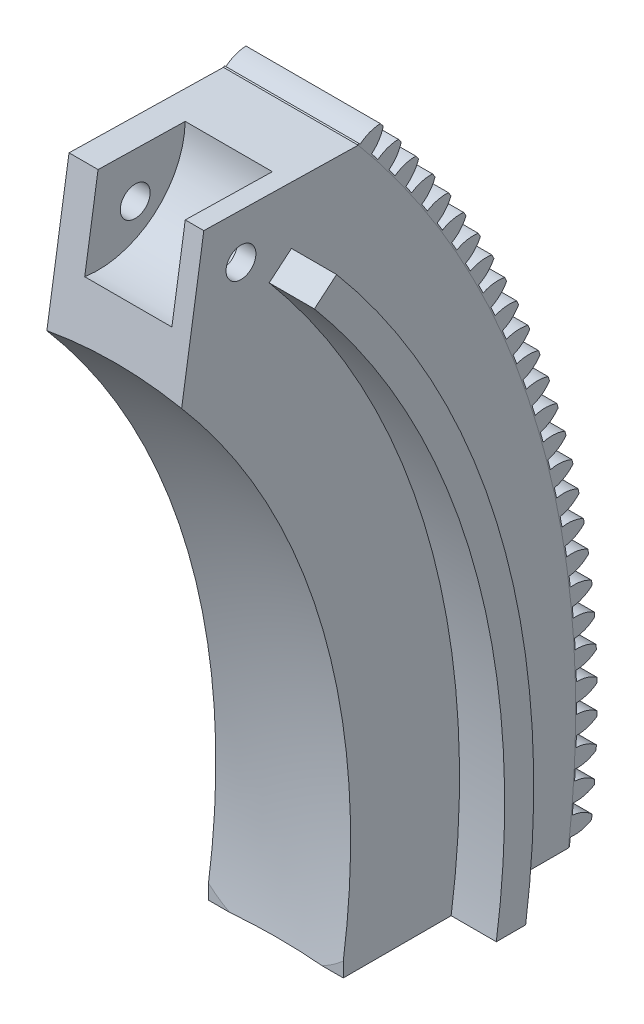
from build123d import *

# Parameters (mm, degrees)
BOSS_EXTRUDE2_DEPTH     = 6.35
BOSS_EXTRUDE3_START     = 29.464
BOSS_EXTRUDE3_DEPTH     = 29.464
CUT_EXTRUDE4_DEPTH      = 6.35
CIRPATTERN3_COUNT       = 206
CUT_EXTRUDE7_DEPTH      = 248.520050541
CUT_EXTRUDE7_DEPTH_BACK = 248.520050541
SKETCH15_R              = 3.2639
BOSS_EXTRUDE4_DEPTH     = 9.87425
SKETCH24_W              = 19.05
SKETCH24_H              = 19.05
BOSS_EXTRUDE6_START     = 23.01875
BOSS_EXTRUDE6_DEPTH     = 23.01875


with BuildPart() as part:
    # Sketch11 → Boss-Extrude2 (new body)
    with BuildSketch(Plane(origin=(6.35, 0, 0), x_dir=(0, 0, -1), z_dir=(1, 0, 0))):
        with BuildLine():
            Line((159.337249268, 133.699827093), (155.660230842, 130.614442288))
            ThreePointArc((155.660230842, 130.614442288), (190.945540544, 69.498493124), (203.2, 0))
            ThreePointArc((203.2, 0), (202.801171077, -12.724975829), (201.606249903, -25.4))
            Line((201.606249903, -25.4), (206.443316116, -25.4))
            ThreePointArc((206.443316116, -25.4), (207.610469263, -12.72382888), (208.000006656, 0))
            ThreePointArc((208.000006656, 0), (195.456071378, 71.140192088), (159.337249268, 133.699827093))
        make_face()
    extrude(amount=-BOSS_EXTRUDE2_DEPTH)

    # Sketch1 → Boss-Extrude3 (add)
    with BuildSketch(Plane(origin=(0, 0, 0), x_dir=(0, 0, -1), z_dir=(1, 0, 0)).offset(BOSS_EXTRUDE3_START)):
        with BuildLine():
            Line((152.4, 0), (152.4, -25.4))
            Line((152.4, -25.4), (201.606249903, -25.4))
            ThreePointArc((201.606249903, -25.4), (202.801171077, -12.724975829), (203.2, 0))
            ThreePointArc((203.2, 0), (190.945540544, 69.498493124), (155.660230842, 130.614442288))
            Line((155.660230842, 130.614442288), (121.916747361, 131.312974751))
            Line((121.916747361, 131.312974751), (116.745173131, 97.960831716))
            ThreePointArc((116.745173131, 97.960831716), (143.209155408, 52.123869843), (152.4, 0))
        make_face()
    extrude(amount=-BOSS_EXTRUDE3_DEPTH)

    # Sketch12 → Cut-Extrude4 (cut)
    with BuildSketch(Plane(origin=(6.35, 0, 0), x_dir=(0, 0, -1), z_dir=(1, 0, 0))):
        with BuildLine():
            ThreePointArc((203.496905889, 1.123362858), (206.492077476, 1.772772167), (208.969392364, 3.577126965))
            ThreePointArc((208.969392364, 3.577126965), (209.000006656, 0), (208.969392364, -3.577126965))
            ThreePointArc((208.969392364, -3.577126965), (206.492077476, -1.772772167), (203.496905889, -1.123362858))
            ThreePointArc((203.496905889, -1.123362858), (203.500006512, 0), (203.496905889, 1.123362858))
        make_face()
    cut_extrude4 = extrude(amount=-CUT_EXTRUDE4_DEPTH, mode=Mode.SUBTRACT)

    # CirPattern3: Cut-Extrude4 ×206 about axis
    cirpattern3_axis = Axis((0, 0, 0), (1, 0, 0))
    for i in range(1, CIRPATTERN3_COUNT):
        add(cut_extrude4.rotate(cirpattern3_axis, i * 360 / CIRPATTERN3_COUNT), mode=Mode.SUBTRACT)

    # Sketch15 → Cut-Extrude7 (cut, two sides: drawn at the far end of the back side and taken through both)
    with BuildSketch(Plane(origin=(6.35, 0, 0), x_dir=(0, 0, -1), z_dir=(1, 0, 0)).offset(-CUT_EXTRUDE7_DEPTH_BACK)):
        with Locations((130.034688148, 121.259308419)):
            Circle(SKETCH15_R)
    extrude(amount=CUT_EXTRUDE7_DEPTH + CUT_EXTRUDE7_DEPTH_BACK, mode=Mode.SUBTRACT)

    # Sketch21 → Cut-Revolve7 (revolve, cut)
    with BuildSketch(Plane(origin=(0, 0, 0), x_dir=(1, 0, 0), z_dir=(0, 1, 0))):
        with BuildLine():
            Line((-76.177622652, 38.1), (-102.108, 38.1))
            ThreePointArc((-102.108, 38.1), (14.732, 154.94), (131.572, 38.1))
            Line((131.572, 38.1), (105.641622652, 38.1))
            Line((105.641622652, 38.1), (-76.177622652, 38.1))
        make_face()
    revolve(axis=Axis((-1000, 0, 0), (1, 0, 0)), mode=Mode.SUBTRACT)

    # Sketch23 → Boss-Extrude4 (add)
    with BuildSketch(Plane(origin=(0, 0, 0), x_dir=(0, 0, -1), z_dir=(1, 0, 0))):
        with BuildLine():
            Line((136.202701987, 114.287637002), (141.0670842, 118.369338324))
            ThreePointArc((141.0670842, 118.369338324), (173.044396118, 62.983009393), (184.15, 0))
            ThreePointArc((184.15, 0), (183.709439007, -12.730456381), (182.389864028, -25.4))
            Line((182.389864028, -25.4), (175.976362049, -25.4))
            ThreePointArc((175.976362049, -25.4), (177.343504494, -12.732690754), (177.8, 0))
            ThreePointArc((177.8, 0), (167.077347976, 60.811181483), (136.202701987, 114.287637002))
        make_face()
    boss_extrude4 = extrude(amount=-BOSS_EXTRUDE4_DEPTH)

    # Mirror2: Boss-Extrude4 across plane
    add(boss_extrude4.mirror(Plane(origin=(14.732, 0, 0), x_dir=(0, 0, 1), z_dir=(1, 0, 0))))

    # Sketch24 → Cut-Revolve8 (revolve, cut)
    with BuildSketch(Plane(origin=(0, -15.377424259, -99.170973978), x_dir=(1, 0, 0), z_dir=(0, 0.15322859214167278, 0.9881907703223508))):
        with Locations((15.875, 138.918401229)):
            Rectangle(SKETCH24_W, SKETCH24_H)
    revolve(axis=Axis((0, 131.312974751, -121.916747361), (1, 0, 0)), mode=Mode.SUBTRACT)

    # Sketch27 → Boss-Extrude6 (add)
    with BuildSketch(Plane(origin=(6.35, 0, 0), x_dir=(0, 0, -1), z_dir=(1, 0, 0)).offset(BOSS_EXTRUDE6_START)):
        with BuildLine():
            Line((155.890049163, 130.807282757), (155.660230842, 130.614442288))
            ThreePointArc((155.660230842, 130.614442288), (194.922962004, 57.404519712), (201.606249903, -25.4))
            Line((201.606249903, -25.4), (201.908624507, -25.4))
            ThreePointArc((201.908624507, -25.4), (202.016697904, -24.525627784), (202.120984821, -23.650795875))
            ThreePointArc((202.120984821, -23.650795875), (204.52175744, -23.539887415), (206.761180022, -22.667536365))
            ThreePointArc((206.761180022, -22.667536365), (206.815923358, -22.162504697), (206.869433114, -21.657340837))
            ThreePointArc((206.869433114, -21.657340837), (204.865699514, -20.330290907), (202.54293904, -19.71320612))
            ThreePointArc((202.54293904, -19.71320612), (202.648674045, -18.594826116), (202.748233746, -17.475879472))
            ThreePointArc((202.748233746, -17.475879472), (205.144507443, -17.291808226), (207.356285067, -16.351569108))
            ThreePointArc((207.356285067, -16.351569108), (207.395601409, -15.845102875), (207.433680713, -15.338542133))
            ThreePointArc((207.433680713, -15.338542133), (205.390409142, -14.073215637), (203.049910298, -13.527253166))
            ThreePointArc((203.049910298, -13.527253166), (203.121489817, -12.406168826), (203.186879623, -11.284706433))
            ThreePointArc((203.186879623, -11.284706433), (205.576425306, -11.02764363), (207.758500503, -10.020391085))
            ThreePointArc((207.758500503, -10.020391085), (207.782353278, -9.51296142), (207.804966708, -9.005475015))
            ThreePointArc((207.804966708, -9.005475015), (205.724057883, -7.803049001), (203.36799788, -7.328716719))
            ThreePointArc((203.36799788, -7.328716719), (203.405355326, -6.205970912), (203.436514411, -5.083035991))
            ThreePointArc((203.436514411, -5.083035991), (205.817109245, -4.753220759), (207.967452178, -3.679891766))
            ThreePointArc((207.967452178, -3.679891766), (207.975819197, -3.171970697), (207.982945717, -2.664030709))
            ThreePointArc((207.982945717, -2.664030709), (205.866335368, -1.525623714), (203.496905889, -1.123362858))
            ThreePointArc((203.496905889, -1.123362858), (203.500006512, 0), (203.496905889, 1.123362858))
            ThreePointArc((203.496905889, 1.123362858), (205.866335368, 1.525623714), (207.982945717, 2.664030709))
            ThreePointArc((207.982945717, 2.664030709), (207.975819197, 3.171970697), (207.967452178, 3.679891766))
            ThreePointArc((207.967452178, 3.679891766), (205.817109245, 4.753220759), (203.436514411, 5.083035991))
            ThreePointArc((203.436514411, 5.083035991), (203.405355326, 6.205970912), (203.36799788, 7.328716719))
            ThreePointArc((203.36799788, 7.328716719), (205.724057883, 7.803049001), (207.804966708, 9.005475015))
            ThreePointArc((207.804966708, 9.005475015), (207.782353278, 9.51296142), (207.758500503, 10.020391085))
            ThreePointArc((207.758500503, 10.020391085), (205.576425306, 11.02764363), (203.186879623, 11.284706433))
            ThreePointArc((203.186879623, 11.284706433), (203.121489817, 12.406168826), (203.049910298, 13.527253166))
            ThreePointArc((203.049910298, 13.527253166), (205.390409142, 14.073215637), (207.433680713, 15.338542133))
            ThreePointArc((207.433680713, 15.338542133), (207.395601409, 15.845102875), (207.356285067, 16.351569108))
            ThreePointArc((207.356285067, 16.351569108), (205.144507443, 17.291808226), (202.748233746, 17.475879472))
            ThreePointArc((202.748233746, 17.475879472), (202.648674045, 18.594826116), (202.54293904, 19.71320612))
            ThreePointArc((202.54293904, 19.71320612), (204.865699514, 20.330290907), (206.869433114, 21.657340837))
            ThreePointArc((206.869433114, 21.657340837), (206.815923358, 22.162504697), (206.761180022, 22.667536365))
            ThreePointArc((206.761180022, 22.667536365), (204.52175744, 23.539887415), (202.120984821, 23.650795875))
            ThreePointArc((202.120984821, 23.650795875), (201.987347839, 24.766185889), (201.847555705, 25.880821204))
            ThreePointArc((201.847555705, 25.880821204), (204.150417103, 26.568454274), (206.112748792, 27.955993173))
            ThreePointArc((206.112748792, 27.955993173), (206.043858361, 28.45929023), (205.973738955, 28.962417538))
            ThreePointArc((205.973738955, 28.962417538), (203.708754599, 29.76606903), (201.305716335, 29.803711534))
            ThreePointArc((201.305716335, 29.803711534), (201.138126386, 30.914507345), (200.964407163, 32.0243611))
            ThreePointArc((200.964407163, 32.0243611), (203.245227287, 32.781902795), (205.164331641, 34.228639929))
            ThreePointArc((205.164331641, 34.228639929), (205.080124619, 34.729602), (204.994694371, 35.230356922))
            ThreePointArc((204.994694371, 35.230356922), (202.706255202, 35.964561273), (200.303186679, 35.928902803))
            ThreePointArc((200.303186679, 35.928902803), (200.10179966, 37.034071114), (199.894314948, 38.138110887))
            ThreePointArc((199.894314948, 38.138110887), (202.150972104, 38.964856516), (204.025063908, 40.469446082))
            ThreePointArc((204.025063908, 40.469446082), (203.925618628, 40.967607156), (203.824957007, 41.465523873))
            ThreePointArc((203.824957007, 41.465523873), (201.515191808, 42.129598103), (199.114328438, 42.020671831))
            ThreePointArc((199.114328438, 42.020671831), (198.879331686, 43.119184577), (198.638274493, 44.216383353))
            ThreePointArc((198.638274493, 44.216383353), (200.868669465, 45.111563851), (202.696005379, 46.672606232))
            ThreePointArc((202.696005379, 46.672606232), (202.581414347, 47.167502903), (202.465614992, 47.662118237))
            ThreePointArc((202.465614992, 47.662118237), (200.136672382, 48.255444601), (197.740247527, 48.073351853))
            ThreePointArc((197.740247527, 48.073351853), (197.471859644, 49.164187162), (197.197454209, 50.253524292))
            ThreePointArc((197.197454209, 50.253524292), (199.399512211, 51.216306932), (201.178392386, 52.832349994))
            ThreePointArc((201.178392386, 52.832349994), (201.048762199, 53.323521893), (200.917932831, 53.814375736))
            ThreePointArc((200.917932831, 53.814375736), (198.571979268, 54.336402303), (196.182222161, 54.081312469))
            ThreePointArc((196.182222161, 54.081312469), (195.88069281, 55.16345561), (195.573194395, 56.243917756))
            ThreePointArc((195.573194395, 56.243917756), (197.744867, 57.273406927), (199.473636663, 58.942947374))
            ThreePointArc((199.473636663, 58.942947374), (199.329087908, 59.429937596), (199.183350228, 59.916573341))
            ThreePointArc((199.183350228, 59.916573341), (196.822567995, 60.366814505), (194.441701666, 60.038964877))
            ThreePointArc((194.441701666, 60.038964877), (194.10731134, 61.111409204), (193.767005989, 62.181991286))
            ThreePointArc((193.767005989, 62.181991286), (195.906273036, 63.277229323), (197.583324031, 64.998714094))
            ThreePointArc((197.583324031, 64.998714094), (197.42399117, 65.481069626), (197.263480748, 65.963034587))
            ThreePointArc((197.263480748, 65.963034587), (194.890065923, 66.341071518), (192.520305132, 65.940767073))
            ThreePointArc((192.520305132, 65.940767073), (192.153364891, 67.002514964), (191.780569168, 68.062221091))
            ThreePointArc((191.780569168, 68.062221091), (193.885440641, 69.222189168), (195.509212918, 70.994016881))
            ThreePointArc((195.509212918, 70.994016881), (195.33524417, 71.471289019), (195.160110318, 71.948134857))
            ThreePointArc((195.160110318, 71.948134857), (192.776270728, 72.253615894), (190.419819905, 71.781229008))
            ThreePointArc((190.419819905, 71.781229008), (190.020671088, 72.831292791), (189.61573178, 73.879137189))
            ThreePointArc((189.61573178, 73.879137189), (191.684249659, 75.102756265), (193.253232733, 76.923278708))
            ThreePointArc((193.253232733, 76.923278708), (193.064789927, 77.395023479), (192.875195561, 77.866306616))
            ThreePointArc((192.875195561, 77.866306616), (190.483148732, 78.09894759), (188.142199924, 77.554917692))
            ThreePointArc((188.142199924, 77.554917692), (187.711213834, 78.592320563), (187.274507628, 79.627328493))
            ThreePointArc((187.274507628, 79.627328493), (189.304747709, 80.913460318), (190.81748206, 82.780983982))
            ThreePointArc((190.81748206, 82.780983982), (190.614740494, 83.246762552), (190.41086198, 83.712044586))
            ThreePointArc((190.41086198, 83.712044586), (188.012833073, 83.871629087), (185.689563906, 83.256462252))
            ThreePointArc((185.689563906, 83.256462252), (185.22714146, 84.280239185), (184.759074595, 85.301447849))
            ThreePointArc((184.759074595, 85.301447849), (186.749148282, 86.64889602), (188.204226716, 88.561683673))
            ThreePointArc((188.204226716, 88.561683673), (187.987374985, 89.021062761), (187.769401979, 89.479910871))
            ThreePointArc((187.769401979, 89.479910871), (185.367621717, 89.566290448), (183.064193374, 88.880558924))
            ThreePointArc((183.064193374, 88.880558924), (182.570764732, 89.889757567), (182.07177262, 90.896217003))
            ThreePointArc((182.07177262, 90.896217003), (184.019828682, 92.303728081), (185.415897636, 94.260000386))
            ThreePointArc((185.415897636, 94.260000386), (185.185137463, 94.712552661), (184.953272729, 95.164540011))
            ThreePointArc((184.953272729, 95.164540011), (182.549975329, 95.177634311), (180.268530534, 94.421975989))
            ThreePointArc((180.268530534, 94.421975989), (179.744554699, 95.415657553), (179.215101518, 96.40643152))
            ThreePointArc((179.215101518, 96.40643152), (181.119327809, 97.872696191), (182.455088615, 99.870633359))
            ThreePointArc((182.455088615, 99.870633359), (182.210634661, 100.315937843), (181.965093888, 100.76064398))
            ThreePointArc((181.965093888, 100.76064398), (179.562514975, 100.700440822), (177.305176002, 99.875558639))
            ThreePointArc((177.305176002, 99.875558639), (176.751140395, 100.852798769), (176.191718658, 101.826965616))
            ThreePointArc((176.191718658, 101.826965616), (178.050343805, 103.350619914), (179.324553894, 105.388363397))
            ThreePointArc((179.324553894, 105.388363397), (179.066633558, 105.826005854), (178.807645156, 106.263017097))
            ThreePointArc((178.807645156, 106.263017097), (176.408019688, 106.129572484), (174.176886388, 105.236233773))
            ThreePointArc((174.176886388, 105.236233773), (173.59330639, 106.196123408), (173.004436491, 107.152776934))
            ThreePointArc((173.004436491, 107.152776934), (174.81573154, 108.732403504), (176.0272056, 110.808057728))
            ThreePointArc((176.0272056, 110.808057728), (175.756058808, 111.237631047), (175.483863697, 111.666540875))
            ThreePointArc((175.483863697, 111.666540875), (173.089423883, 111.459978942), (170.886571729, 110.499014716))
            ThreePointArc((170.886571729, 110.499014716), (170.273990206, 111.440660935), (169.656219931, 112.378911229))
            ThreePointArc((169.656219931, 112.378911229), (171.418499956, 114.013040652), (172.566111034, 116.124674775))
            ThreePointArc((172.566111034, 116.124674775), (172.281990016, 116.545779353), (171.996841399, 116.96618878))
            ThreePointArc((171.996841399, 116.96618878), (169.609814626, 116.686701677), (167.437292784, 115.659005856))
            ThreePointArc((167.437292784, 115.659005856), (166.796279579, 116.58153271), (166.150183599, 117.50050698))
            ThreePointArc((166.150183599, 117.50050698), (167.861809268, 119.187619135), (168.944489819, 121.333268845))
            ThreePointArc((168.944489819, 121.333268845), (168.647658873, 121.745512958), (168.349822006, 122.157030904))
            ThreePointArc((168.349822006, 122.157030904), (165.972428765, 121.80487862), (163.832258185, 120.7114072))
            ThreePointArc((163.832258185, 120.7114072), (163.16340959, 121.613956524), (162.489588923, 122.512799911))
            ThreePointArc((162.489588923, 122.512799911), (164.148968027, 124.251325391), (165.165710906, 126.428994735))
            ThreePointArc((165.165710906, 126.428994735), (164.856446155, 126.831994899), (164.546198095, 127.234238558))
            ThreePointArc((164.546198095, 127.234238558), (162.180649914, 126.809748675), (160.074821454, 125.65151884))
            ThreePointArc((160.074821454, 125.65151884), (159.378759653, 126.533251052), (158.67784111, 127.411127423))
            ThreePointArc((158.67784111, 127.411127423), (160.28343004, 129.199448994), (161.23328944, 131.407112233))
            ThreePointArc((161.23328944, 131.407112233), (160.91187857, 131.800493565), (160.589507921, 132.193088755))
            ThreePointArc((160.589507921, 132.193088755), (158.238005311, 131.696656149), (156.168477881, 130.474745321))
            ThreePointArc((156.168477881, 130.474745321), (156.029352112, 130.641088214), (155.890049163, 130.807282757))
        make_face()
    extrude(amount=-BOSS_EXTRUDE6_DEPTH)


solid = part.part
